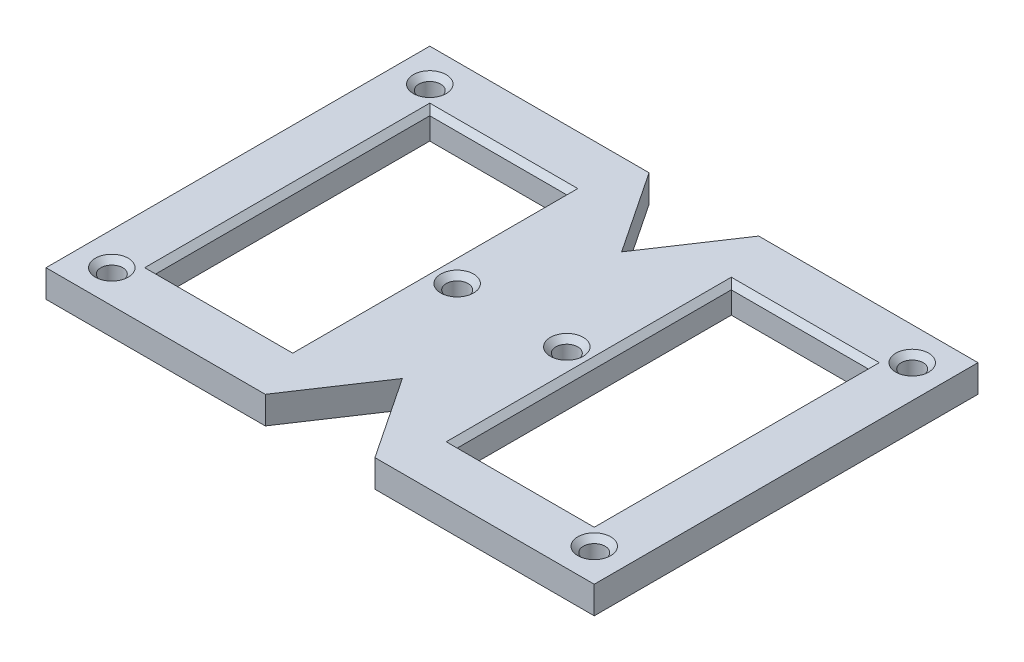
from build123d import *

# Parameters (mm, degrees)
CROQUIS1_W              = 100
CROQUIS1_H              = 70
SALIENTE_EXTRUIR1_DEPTH = 5
CROQUIS3_R              = 2
CORTAR_EXTRUIR2_DEPTH   = 62.23724357
CROQUIS6_R              = 2
CORTAR_EXTRUIR3_DEPTH   = 62.23724357
CROQUIS7_W              = 25
CROQUIS7_H              = 50
CORTAR_EXTRUIR4_DEPTH   = 62.23724357
CORTAR_EXTRUIR5_DEPTH   = 62.23724357
CHAFL_N1_SIZE           = 1


with BuildPart() as part:
    # Croquis1 → Saliente-Extruir1 (new body)
    with BuildSketch(Plane(origin=(0, 0, 0), x_dir=(1, 0, 0), z_dir=(0, 1, 0))):
        Rectangle(CROQUIS1_W, CROQUIS1_H)
    extrude(amount=SALIENTE_EXTRUIR1_DEPTH)

    # Croquis3 → Cortar-Extruir2 (cut, through all)
    with BuildSketch(Plane(origin=(0, 5, 0), x_dir=(1, 0, 0), z_dir=(0, 1, 0))):
        with Locations((-44, 29)):
            Circle(CROQUIS3_R)
        with Locations((44, 29)):
            Circle(CROQUIS3_R)
        with Locations((44, -29)):
            Circle(CROQUIS3_R)
        with Locations((-44, -29)):
            Circle(CROQUIS3_R)
    extrude(amount=-CORTAR_EXTRUIR2_DEPTH, mode=Mode.SUBTRACT)

    # Croquis6 → Cortar-Extruir3 (cut, through all)
    with BuildSketch(Plane(origin=(0, 5, 0), x_dir=(1, 0, 0), z_dir=(0, 1, 0))):
        with Locations((-10, 0)):
            Circle(CROQUIS6_R)
        with Locations((10, 0)):
            Circle(CROQUIS6_R)
    extrude(amount=-CORTAR_EXTRUIR3_DEPTH, mode=Mode.SUBTRACT)

    # Croquis7 → Cortar-Extruir4 (cut, through all)
    with BuildSketch(Plane.XZ):
        with Locations((-27.5, 0)):
            Rectangle(CROQUIS7_W, CROQUIS7_H)
        with Locations((27.5, 0)):
            Rectangle(CROQUIS7_W, CROQUIS7_H)
    extrude(amount=-CORTAR_EXTRUIR4_DEPTH, mode=Mode.SUBTRACT)

    # Croquis8 → Cortar-Extruir5 (cut, through all)
    with BuildSketch(Plane(origin=(0, 5, 0), x_dir=(1, 0, 0), z_dir=(0, 1, 0))):
        Polygon((-10, 35), (0, 20), (10, 35), align=None)
    cortar_extruir5 = extrude(amount=-CORTAR_EXTRUIR5_DEPTH, mode=Mode.SUBTRACT)

    # Simetría1: Cortar-Extruir5 across plane
    add(cortar_extruir5.mirror(Plane.XY), mode=Mode.SUBTRACT)

    # Chaflán1
    chafl_n1_edges = [part.edges().sort_by_distance(p)[0] for p in [
        (42, 5, 29),
        (42, 5, -29),
        (8, 5, 0),
        (-12, 5, 0),
        (-46, 5, 29),
        (-46, 5, -29),
        (27.5, 5, 25),
        (40, 5, 0),
        (15, 5, 0),
        (27.5, 5, -25),
        (-27.5, 5, 25),
        (-15, 5, 0),
        (-27.5, 5, -25),
        (-40, 5, 0),
    ]]
    chamfer(chafl_n1_edges, length=CHAFL_N1_SIZE)


solid = part.part
